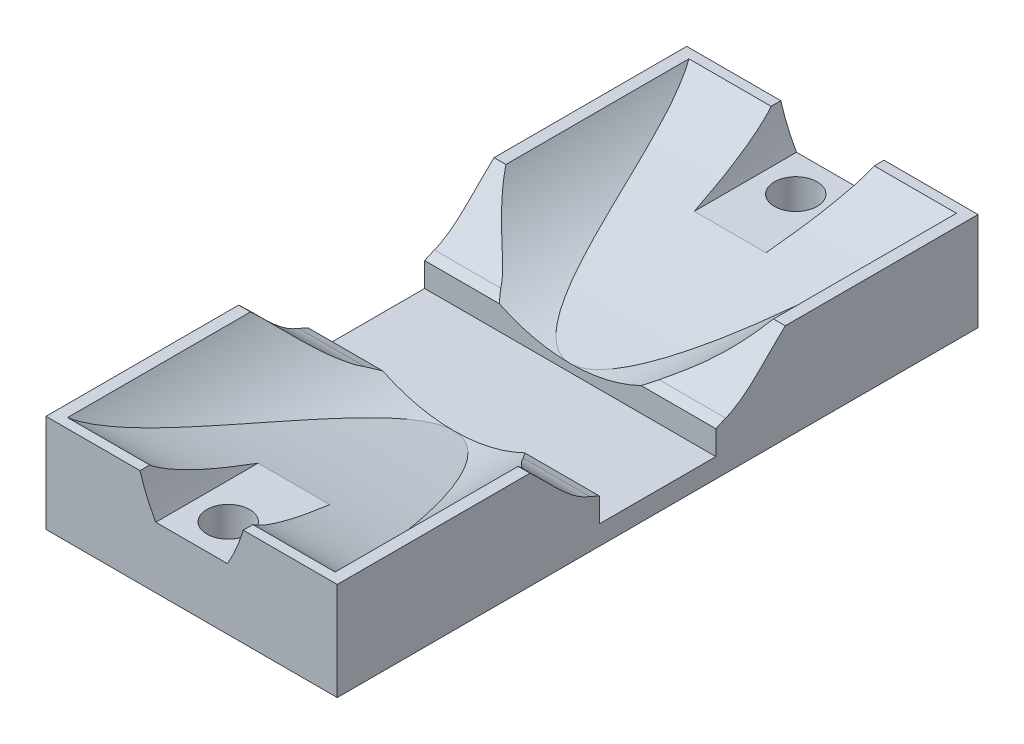
from build123d import *

# Parameters (mm, degrees)
BOSS_EXTRUDE1_DEPTH     = 15.045877519
BOSS_EXTRUDE2_DEPTH     = 30
BOSS_EXTRUDE3_DEPTH     = 160
CUT_EXTRUDE1_DEPTH      = 397.42670329
CUT_EXTRUDE1_DEPTH_BACK = 397.42670329
SKETCH5_W               = 30
SKETCH5_H               = 30
CUT_EXTRUDE2_START      = -30
CUT_EXTRUDE2_DEPTH      = 30
CUT_EXTRUDE3_DEPTH      = 2.010455065
BOSS_EXTRUDE6_START     = -34.448076
BOSS_EXTRUDE6_DEPTH     = 68.896152
SKETCH13_W              = 15
SKETCH13_H              = 30
BOSS_EXTRUDE7_DEPTH     = 10
SKETCH14_W              = 15
SKETCH14_H              = 30
BOSS_EXTRUDE8_DEPTH     = 10
CUT_EXTRUDE6_DEPTH      = 192
SKETCH18_R              = 3
CUT_EXTRUDE7_DEPTH      = 192
CUT_EXTRUDE8_REACH      = 232.854
SKETCH19_R              = 5.5
FILLET2_R               = 2.5
CUT_EXTRUDE9_DEPTH      = 100
CUT_EXTRUDE10_REACH     = 175.937
SKETCH21_W              = 180
SKETCH21_H              = 8.035422455
CUT_EXTRUDE11_REACH     = 233.991
SKETCH23_W              = 100
SKETCH23_H              = 180
SKETCH23_W_2            = 85
SKETCH23_H_2            = 165
SKETCH25_W              = 158.518462152
SKETCH25_H              = 257.490538006
CUT_EXTRUDE12_DEPTH     = 33
SKETCH26_W              = 129.878262085
SKETCH26_H              = 202.68880295
SKETCH26_W_2            = 75
SKETCH26_H_2            = 173.162616497
CUT_EXTRUDE13_DEPTH     = 33


# Read off the part's stored shape, not the designer's step: Boss-Extrude3
with BuildPart() as part:
    # Sketch1 → Boss-Extrude1 (new body)
    with BuildSketch(Plane(origin=(0, 0, 0), x_dir=(1, 0, 0), z_dir=(0, 1, 0))):
        with BuildLine():
            Line((-185, -65), (5, -65))
            ThreePointArc((5, -65), (60.514401442, -84.704810384), (91.182336182, -135))
            Line((91.182336182, -135), (185, -135))
            Line((185, -135), (185, 135))
            Line((185, 135), (-185, 135))
            Line((-185, 135), (-185, -65))
        make_face()
    extrude(amount=BOSS_EXTRUDE1_DEPTH)

    # Sketch2 → Boss-Extrude2 (add)
    with BuildSketch(Plane(origin=(0, 15.045877519, 0), x_dir=(1, 0, 0), z_dir=(0, 1, 0))):
        Polygon((-175, -35), (-175, 30), (-185, 30), (-185, -45), (-142.5, -45), (-142.5, -35), align=None)
        Polygon((-175, 125), (-142.5, 125), (-142.5, 135), (-185, 135), (-185, 60), (-175, 60), align=None)
        Polygon((-95, -35), (-95, 30), (-85, 30), (-85, -45), (-127.5, -45), (-127.5, -35), align=None)
        Polygon((-127.5, 135), (-127.5, 125), (-95, 125), (-95, 60), (-85, 60), (-85, 135), align=None)
    extrude(amount=BOSS_EXTRUDE2_DEPTH)

    # Boss-Extrude3 outline → Boss-Extrude3 (add)
    with BuildSketch(Plane.XY.offset(-125)):
        with BuildLine():
            ThreePointArc((-95, 45.045877519), (-110, 23.379210852), (-135, 15.045877519))
            Line((-135, 15.045877519), (-95, 15.045877519))
            Line((-95, 15.045877519), (-95, 45.045877519))
        make_face()
        with BuildLine():
            Line((-175, 45.045877519), (-175, 15.045877519))
            Line((-175, 15.045877519), (-135, 15.045877519))
            ThreePointArc((-135, 15.045877519), (-160, 23.379210852), (-175, 45.045877519))
        make_face()
    extrude(amount=BOSS_EXTRUDE3_DEPTH)

    # Sketch5 → Cut-Extrude1 (cut, two sides: drawn at the far end of the back side and taken through both)
    with BuildSketch(Plane.ZY.offset(185).offset(-CUT_EXTRUDE1_DEPTH_BACK)):
        with Locations((-45, 30.045877519)):
            Rectangle(SKETCH5_W, SKETCH5_H)
    extrude(amount=CUT_EXTRUDE1_DEPTH + CUT_EXTRUDE1_DEPTH_BACK, mode=Mode.SUBTRACT)

    # Sketch6 → Cut-Extrude2 (cut)
    with BuildSketch(Plane(origin=(0, 15.045877519, 0), x_dir=(1, 0, 0), z_dir=(0, 1, 0)).offset(CUT_EXTRUDE2_START)):
        with BuildLine():
            Line((-85, 135), (-85, 60))
            Line((-85, 60), (-85, 30))
            Line((-85, 30), (-85, -45))
            Line((-85, -45), (-127.5, -45))
            Line((-127.5, -45), (-142.5, -45))
            Line((-142.5, -45), (-185, -45))
            Line((-185, -45), (-185, -65))
            Line((-185, -65), (5, -65))
            ThreePointArc((5, -65), (60.514401442, -84.704810384), (91.182336182, -135))
            Line((91.182336182, -135), (185, -135))
            Line((185, -135), (185, 135))
            Line((185, 135), (-85, 135))
        make_face()
    extrude(amount=CUT_EXTRUDE2_DEPTH, mode=Mode.SUBTRACT)

    # Sketch8 → Cut-Extrude3 (cut)
    with BuildSketch(Plane(origin=(0, 15.045877519, 0), x_dir=(1, 0, 0), z_dir=(0, 1, 0))):
        Polygon((-135, 60), (-185, 60), (-185, 30), (-135, 30), (-85, 30), (-85, 60), align=None)
    extrude(amount=-CUT_EXTRUDE3_DEPTH, mode=Mode.SUBTRACT)

    # Sketch12 → Boss-Extrude6 (add)
    with BuildSketch(Plane(origin=(-135, 0, 0), x_dir=(0, 0, -1), z_dir=(1, 0, 0)).offset(BOSS_EXTRUDE6_START)):
        with BuildLine():
            Line((-35, 33.272382456), (-35, 15.00790917))
            Line((-35, 15.00790917), (30, 15.045877519))
            add(Edge.make_bspline(
                [(-35, 33.272382456), (-23.622698209, 24.45769668), (30, 15.045877519)],
                knots=[0, 0, 0, 1, 1, 1], degree=2))
        make_face()
    boss_extrude6 = extrude(amount=BOSS_EXTRUDE6_DEPTH)

    # Sketch13 → Boss-Extrude7 (add)
    with BuildSketch(Plane.XY.offset(45)):
        with Locations((-135, 30.045877519)):
            Rectangle(SKETCH13_W, SKETCH13_H)
    extrude(amount=-BOSS_EXTRUDE7_DEPTH)

    # Sketch14 → Boss-Extrude8 (add)
    with BuildSketch(Plane(origin=(0, 0, -135), x_dir=(-1, 0, 0), z_dir=(0, 0, -1))):
        with Locations((135, 30.045877519)):
            Rectangle(SKETCH14_W, SKETCH14_H)
    extrude(amount=-BOSS_EXTRUDE8_DEPTH)

    # Mirror3: Boss-Extrude6 across plane
    add(boss_extrude6.mirror(Plane.XY.offset(-45)))

    # Sketch9 → Cut-Extrude6 (cut)
    with BuildSketch(Plane.XY.offset(45)):
        with BuildLine():
            Line((-150, 45.045877519), (-120, 45.045877519))
            ThreePointArc((-120, 45.045877519), (-121.500780237, 34.041891851), (-125.767198961, 23.788223571))
            Line((-125.767198961, 23.788223571), (-144.232801039, 23.788223571))
            ThreePointArc((-144.232801039, 23.788223571), (-148.499219763, 34.041891851), (-150, 45.045877519))
        make_face()
    extrude(amount=-CUT_EXTRUDE6_DEPTH, mode=Mode.SUBTRACT)

    # Sketch18 → Cut-Extrude7 (cut)
    with BuildSketch(Plane.XZ):
        with Locations(Location((-135, 28.073614807, 0), (0, 0, 270))):
            Circle(SKETCH18_R)
    cut_extrude7 = extrude(amount=-CUT_EXTRUDE7_DEPTH, mode=Mode.SUBTRACT)

    # Sketch19 → Cut-Extrude8 (cut, up to next)
    with BuildSketch(Plane(origin=(0, 16, 0), x_dir=(-1, 0, 0), z_dir=(0, -1, 0)), mode=Mode.PRIVATE) as cut_extrude8_sk1:
        with Locations(Location((135, -28.073614807, 0), (0, 0, 90))):
            Circle(SKETCH19_R)
    cut_extrude8_tool1 = extrude(cut_extrude8_sk1.sketch, amount=-CUT_EXTRUDE8_REACH, mode=Mode.PRIVATE) & part.part
    cut_extrude8 = cut_extrude8_tool1.solids().sort_by_distance((-135, 16, 28.073615))[0]
    add(cut_extrude8, mode=Mode.SUBTRACT)

    # Mirror4: Cut-Extrude7, Cut-Extrude8 across plane
    add(cut_extrude7.mirror(Plane.XY.offset(-45)), mode=Mode.SUBTRACT)
    add(cut_extrude8.mirror(Plane.XY.offset(-45)), mode=Mode.SUBTRACT)

    # Fillet2
    fillet2_edges = [part.edges().sort_by_distance(p)[0] for p in [
        (-85, 13.035422455, -45),
        (-185, 13.035422455, -45),
        (-185, 29.040649987, -30),
        (-185, 29.040649987, -60),
        (-85, 29.040649987, -60),
        (-85, 29.040649987, -30),
    ]]
    fillet(fillet2_edges, radius=FILLET2_R)

    # Sketch20 → Cut-Extrude9 (cut)
    with BuildSketch(Plane.ZY.offset(185)):
        with BuildLine():
            Line((-98.75, 45.045877519), (-94.074888297, 48.598858452))
            Line((-94.074888297, 48.598858452), (-55.485995166, 48.598858452))
            Line((-55.485995166, 48.598858452), (-55.485995166, 27.991864502))
            Line((-55.485995166, 27.991864502), (-55.485995166, 17.228975941))
            Line((-55.485995166, 17.228975941), (-62.5, 20.379089666))
            add(Edge.make_bspline(
                [(-98.75, 45.045877519), (-78.848479524, 38.804654274), (-75.177653501, 29.653440104), (-68.09451033, 22.415191608), (-62.5, 20.379089666)],
                knots=[0, 0, 0, 0, 0, 1, 1, 1, 1, 1], degree=4))
        make_face()
        with BuildLine():
            Line((-34.514004834, 17.228975941), (-27.5, 20.379089666))
            add(Edge.make_bspline(
                [(8.75, 45.045877519), (-11.151520476, 38.804654274), (-14.822346499, 29.653440104), (-21.90548967, 22.415191608), (-27.5, 20.379089666)],
                knots=[0, 0, 0, 0, 0, 1, 1, 1, 1, 1], degree=4))
            Line((8.75, 45.045877519), (4.074888297, 48.598858452))
            Line((4.074888297, 48.598858452), (-34.514004834, 48.598858452))
            Line((-34.514004834, 48.598858452), (-34.514004834, 27.991864502))
            Line((-34.514004834, 27.991864502), (-34.514004834, 17.228975941))
        make_face()
    extrude(amount=-CUT_EXTRUDE9_DEPTH, mode=Mode.SUBTRACT)

    # Sketch21 → Cut-Extrude10 (cut, up to next)
    with BuildSketch(Plane.ZY.offset(185), mode=Mode.PRIVATE) as cut_extrude10_sk1:
        with Locations((-45, 4.017711228)):
            Rectangle(SKETCH21_W, SKETCH21_H)
    cut_extrude10_tool1 = extrude(cut_extrude10_sk1.sketch, amount=-CUT_EXTRUDE10_REACH, mode=Mode.PRIVATE) & part.part
    add(cut_extrude10_tool1.solids().sort_by_distance((-185, 4.017711, -45))[0], mode=Mode.SUBTRACT)

    # Sketch23 → Cut-Extrude11 (cut, up to next)
    with BuildSketch(Plane(origin=(0, 45.045877519, 0), x_dir=(1, 0, 0), z_dir=(0, 1, 0)), mode=Mode.PRIVATE) as cut_extrude11_sk1:
        with Locations((-135, 45)):
            Rectangle(SKETCH23_W, SKETCH23_H)
        with Locations((-135, 45)):
            Rectangle(SKETCH23_W_2, SKETCH23_H_2, mode=Mode.SUBTRACT)
    cut_extrude11_tool1 = extrude(cut_extrude11_sk1.sketch, amount=-CUT_EXTRUDE11_REACH, mode=Mode.PRIVATE) & part.part
    add(cut_extrude11_tool1.solids().sort_by_distance((-135, 45.045878, -132.940874))[0], mode=Mode.SUBTRACT)

    # Sketch25 → Cut-Extrude12 (cut)
    with BuildSketch(Plane(origin=(0, 33.272382456, 0), x_dir=(-1, 0, 0), z_dir=(0, -1, 0))):
        with Locations((133.368592156, 53.153762082)):
            Rectangle(SKETCH25_W, SKETCH25_H)
    extrude(amount=-CUT_EXTRUDE12_DEPTH, mode=Mode.SUBTRACT)

    # Sketch26 → Cut-Extrude13 (cut)
    with BuildSketch(Plane(origin=(0, 33.272382456, 0), x_dir=(1, 0, 0), z_dir=(0, 1, 0))):
        with Locations((-143.433653383, 47.811217794)):
            Rectangle(SKETCH26_W, SKETCH26_H)
        with Locations((-135, 46.831491375)):
            Rectangle(SKETCH26_W_2, SKETCH26_H_2, mode=Mode.SUBTRACT)
    extrude(amount=-CUT_EXTRUDE13_DEPTH, mode=Mode.SUBTRACT)


solid = part.part
